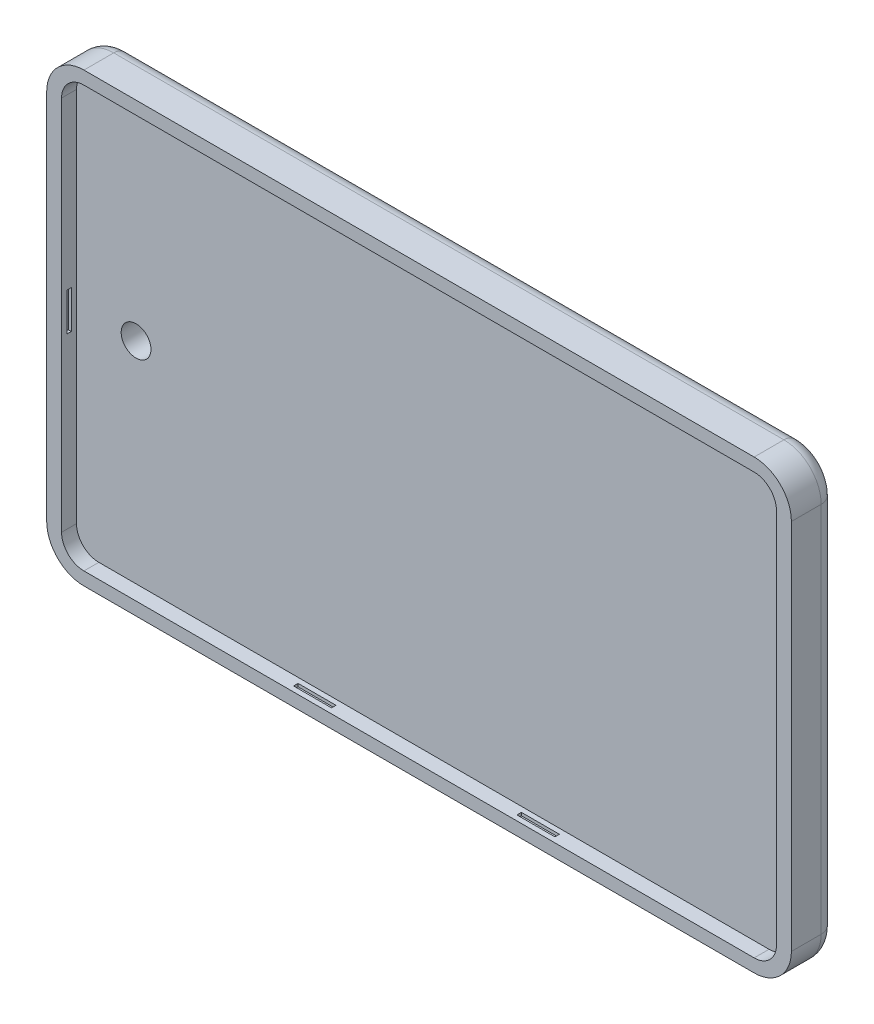
from build123d import *

# Parameters (mm, degrees)
SKETCH_1_W          = 100
SKETCH_1_H          = 60
EXTRUDE_1_DEPTH     = 6
FILLET_1_R          = 5
FILLET_2_R          = 2
CUT_EXTRUDE_1_DEPTH = 2
SKETCH_4_W          = 5.1
SKETCH_4_H          = 0.6
CUT_EXTRUDE_2_DEPTH = 0.4
SKETCH_5_W          = 5.1
SKETCH_5_H          = 0.6
CUT_EXTRUDE_3_DEPTH = 0.4
SKETCH_6_W          = 0.6
SKETCH_6_H          = 5.1
CUT_EXTRUDE_4_DEPTH = 0.4
SKETCH_7_W          = 0.6
SKETCH_7_H          = 5.1
CUT_EXTRUDE_5_DEPTH = 0.4
CUT_EXTRUDE_6_REACH = 60.447
SKETCH_8_R          = 2


with BuildPart() as part:
    # 草图1 → 凸台-拉伸1 (new body)
    with BuildSketch(Plane.XY):
        Rectangle(SKETCH_1_W, SKETCH_1_H)
    extrude(amount=EXTRUDE_1_DEPTH)

    # 圆角1
    fillet_1_edges = [part.edges().sort_by_distance(p)[0] for p in [
        (-50, -30, 3),
        (50, -30, 3),
        (50, 30, 3),
        (-50, 30, 3),
    ]]
    fillet(fillet_1_edges, radius=FILLET_1_R)

    # 圆角2
    fillet_2_edges = [part.edges().sort_by_distance(p)[0] for p in [
        (48.535533906, -28.535533906, 0),
        (50, 0, 0),
        (48.535533906, 28.535533906, 0),
        (0, 30, 0),
        (-48.535533906, 28.535533906, 0),
        (-50, 0, 0),
        (-48.535533906, -28.535533906, 0),
        (0, -30, 0),
    ]]
    fillet(fillet_2_edges, radius=FILLET_2_R)

    # 草图2 → 切除-拉伸1 (cut)
    with BuildSketch(Plane.XY.offset(6)):
        with BuildLine():
            Line((-45, 28.25), (45, 28.25))
            ThreePointArc((45, 28.25), (47.121320344, 27.371320344), (48, 25.25))
            Line((48, 25.25), (48, -25.25))
            ThreePointArc((48, -25.25), (47.121320344, -27.371320344), (45, -28.25))
            Line((45, -28.25), (-45, -28.25))
            ThreePointArc((-45, -28.25), (-47.121320344, -27.371320344), (-48, -25.25))
            Line((-48, -25.25), (-48, 25.25))
            ThreePointArc((-48, 25.25), (-47.121320344, 27.371320344), (-45, 28.25))
        make_face()
    extrude(amount=-CUT_EXTRUDE_1_DEPTH, mode=Mode.SUBTRACT)

    # 草图4 → 切除-拉伸2 (cut)
    with BuildSketch(Plane(origin=(0, -28.25, 0), x_dir=(1, 0, 0), z_dir=(0, 1, 0))):
        with Locations((15, -5)):
            Rectangle(SKETCH_4_W, SKETCH_4_H)
        with Locations((-15, -5)):
            Rectangle(SKETCH_4_W, SKETCH_4_H)
    extrude(amount=-CUT_EXTRUDE_2_DEPTH, mode=Mode.SUBTRACT)

    # 草图5 → 切除-拉伸3 (cut)
    with BuildSketch(Plane.XZ.offset(-28.25)):
        with Locations((-15, 5)):
            Rectangle(SKETCH_5_W, SKETCH_5_H)
        with Locations((15, 5)):
            Rectangle(SKETCH_5_W, SKETCH_5_H)
    extrude(amount=-CUT_EXTRUDE_3_DEPTH, mode=Mode.SUBTRACT)

    # 草图6 → 切除-拉伸4 (cut)
    with BuildSketch(Plane(origin=(-48, 0, 0), x_dir=(0, 0, -1), z_dir=(1, 0, 0))):
        with Locations((-5, 0)):
            Rectangle(SKETCH_6_W, SKETCH_6_H)
    extrude(amount=-CUT_EXTRUDE_4_DEPTH, mode=Mode.SUBTRACT)

    # 草图7 → 切除-拉伸5 (cut)
    with BuildSketch(Plane.ZY.offset(-48)):
        with Locations((5, 0)):
            Rectangle(SKETCH_7_W, SKETCH_7_H)
    extrude(amount=-CUT_EXTRUDE_5_DEPTH, mode=Mode.SUBTRACT)

    # 草图8 → 切除-拉伸6 (cut, up to next)
    with BuildSketch(Plane.XY.offset(4), mode=Mode.PRIVATE) as cut_extrude_6_sk1:
        with Locations((-40, 0)):
            Circle(SKETCH_8_R)
    cut_extrude_6_tool1 = extrude(cut_extrude_6_sk1.sketch, amount=-CUT_EXTRUDE_6_REACH, mode=Mode.PRIVATE) & part.part
    add(cut_extrude_6_tool1.solids().sort_by_distance((-40, 0, 4))[0], mode=Mode.SUBTRACT)


solid = part.part
